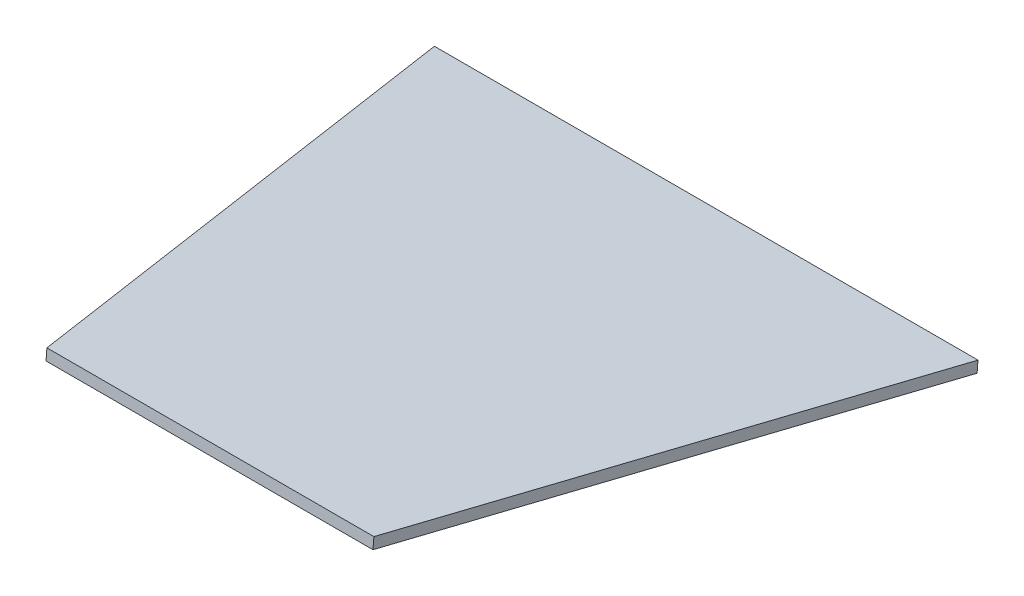
from build123d import *

# Parameters (mm, degrees)
BOSS_EXTRUDE1_DEPTH = 12.7


with BuildPart() as part:
    # Sketch1 → Boss-Extrude1 (new body)
    with BuildSketch(Plane(origin=(-0.000104733, -1306.632218262, 107.788623128), x_dir=(-0.9999999999999969, 7.961414168714261e-08, -6.567661367452002e-09), z_dir=(-7.988457756299226e-08, -0.9966146823530275, 0.08221420143970214))):
        Polygon((927.932358905, -1893.28840213), (1306.839320025, -1893.28840213), (1432.352062753, -1316.739819061), (802.419616177, -1316.739819061), align=None)
    extrude(amount=BOSS_EXTRUDE1_DEPTH)


solid = part.part
